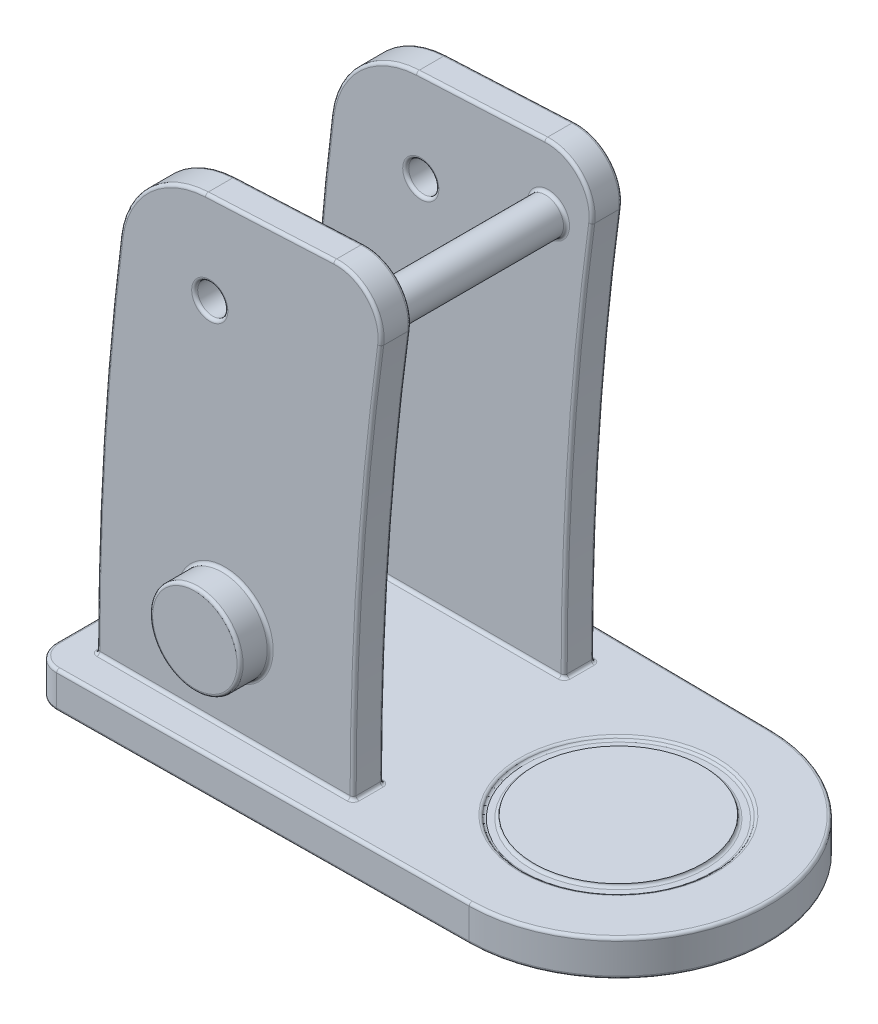
from build123d import *

# Parameters (mm, degrees)
EXTRUDE_1_DEPTH     = 12
SKETCH_2_R          = 32
SKETCH_2_R_2        = 28
CUT_EXTRUDE_1_DEPTH = 1
FILLET_1_R          = 1
EXTRUDE_START       = 40
EXTRUDE_2_DEPTH     = 10
EXTRUDE_START_2     = -30
EXTRUDE_3_DEPTH     = 10
SKETCH_6_R          = 15
EXTRUDE_4_DEPTH     = 10
SKETCH_7_R          = 6
EXTRUDE_5_DEPTH     = 70
SKETCH_8_R          = 5
CUT_EXTRUDE_2_DEPTH = 270.276900019
FILLET_2_R          = 1
FILLET_3_R          = 1


with BuildPart() as part:
    # 草图1 → 凸台-拉伸1 (new body)
    with BuildSketch(Plane(origin=(0, 0, 0), x_dir=(1, 0, 0), z_dir=(0, 1, 0))):
        with BuildLine():
            Line((0, -43.415798737), (0, 43.415798737))
            ThreePointArc((0, 43.415798737), (2.372836655, 49.102188865), (8.083758171, 51.415360261))
            Line((8.083758171, 51.415360261), (143.523488569, 49.997259522))
            ThreePointArc((143.523488569, 49.997259522), (193, 0), (143.523488569, -49.997259522))
            Line((143.523488569, -49.997259522), (8.083758171, -51.415360261))
            ThreePointArc((8.083758171, -51.415360261), (2.372836655, -49.102188865), (0, -43.415798737))
        make_face()
    extrude(amount=EXTRUDE_1_DEPTH)

    # 草图2 → 切除-拉伸1 (cut)
    with BuildSketch(Plane(origin=(0, 12, 0), x_dir=(1, 0, 0), z_dir=(0, 1, 0))):
        with Locations(Location((143, 0, 0), (0, 0, 270))):
            Circle(SKETCH_2_R)
        with Locations(Location((143, 0, 0), (0, 0, 270))):
            Circle(SKETCH_2_R_2, mode=Mode.SUBTRACT)
    extrude(amount=-CUT_EXTRUDE_1_DEPTH, mode=Mode.SUBTRACT)

    # 圆角1
    fillet_1_edges = [part.edges().sort_by_distance(p)[0] for p in [
        (143, 11, -32),
        (143, 11, -28),
    ]]
    fillet(fillet_1_edges, radius=FILLET_1_R - 0.0001)  # a hair under: the kernel refuses the full size

    # 草图5 → 凸台-拉伸2 (add)
    with BuildSketch(Plane.XY.offset(EXTRUDE_START)):
        with BuildLine():
            Line((46.013384531, 161.965520174), (88.572759855, 164.007760087))
            ThreePointArc((88.572759855, 164.007760087), (100.351881391, 159.15775757), (104.154401534, 147))
            ThreePointArc((104.154401534, 147), (97.29122524, 79.655012873), (95, 12))
            Line((95, 12), (10, 12))
            ThreePointArc((10, 12), (11.922285718, 73.974803383), (17.681752509, 135.711340206))
            ThreePointArc((17.681752509, 135.711340206), (27.06020076, 154.004614846), (46.013384531, 161.965520174))
        make_face()
    extrude(amount=-EXTRUDE_2_DEPTH)

    # 草图5<2> → 凸台-拉伸3 (add)
    with BuildSketch(Plane.XY.offset(EXTRUDE_START_2)):
        with BuildLine():
            Line((46.013384531, 161.965520174), (88.572759855, 164.007760087))
            ThreePointArc((88.572759855, 164.007760087), (100.351881391, 159.15775757), (104.154401534, 147))
            ThreePointArc((104.154401534, 147), (97.29122524, 79.655012873), (95, 12))
            Line((95, 12), (10, 12))
            ThreePointArc((10, 12), (11.922285718, 73.974803383), (17.681752509, 135.711340206))
            ThreePointArc((17.681752509, 135.711340206), (27.06020076, 154.004614846), (46.013384531, 161.965520174))
        make_face()
    extrude(amount=-EXTRUDE_3_DEPTH)

    # 草图6 → 凸台-拉伸4 (add)
    with BuildSketch(Plane.XY.offset(40)):
        with Locations(Location((52.5, 42, 0), (0, 0, 180))):
            Circle(SKETCH_6_R)
    extrude(amount=EXTRUDE_4_DEPTH)

    # 草图7 → 凸台-拉伸5 (add)
    with BuildSketch(Plane.XY.offset(40)):
        with Locations(Location((89.797727338, 143.00717369, 0), (0, 0, 180))):
            Circle(SKETCH_7_R)
    extrude(amount=-EXTRUDE_5_DEPTH)

    # 草图8 → 切除-拉伸2 (cut, through all)
    with BuildSketch(Plane(origin=(0, 0, -40), x_dir=(-1, 0, 0), z_dir=(0, 0, -1))):
        with Locations((-47.451299933, 132)):
            Circle(SKETCH_8_R)
    extrude(amount=-CUT_EXTRUDE_2_DEPTH, mode=Mode.SUBTRACT)

    # 圆角2
    fillet_2_edges = [part.edges().sort_by_distance(p)[0] for p in [
        (2.372836655, 12, -49.102188865),
        (0, 12, 0),
        (2.372836655, 12, 49.102188865),
        (143, 12, -32),
        (75.80362337, 12, 50.706309892),
        (11.922285718, 73.974803383, 30),
        (10, 12, 35),
        (27.06020076, 154.004614846, 30),
        (67.293072193, 162.98664013, 30),
        (100.351881391, 159.15775757, 30),
        (97.29122524, 79.655012873, 30),
        (52.5, 12, 30),
        (95, 12, 35),
        (11.922285718, 73.974803383, 40),
        (52.5, 12, 40),
        (97.29122524, 79.655012873, 40),
        (100.351881391, 159.15775757, 40),
        (67.293072193, 162.98664013, 40),
        (27.06020076, 154.004614846, 40),
        (193, 12, 0),
        (11.922285718, 73.974803383, -40),
        (52.5, 12, -40),
        (10, 12, -35),
        (97.29122524, 79.655012873, -40),
        (95, 12, -35),
        (100.351881391, 159.15775757, -40),
        (67.293072193, 162.98664013, -40),
        (27.06020076, 154.004614846, -40),
        (11.922285718, 73.974803383, -30),
        (52.5, 12, -30),
        (97.29122524, 79.655012873, -30),
        (100.351881391, 159.15775757, -30),
        (67.293072193, 162.98664013, -30),
        (27.06020076, 154.004614846, -30),
        (75.80362337, 0, 50.706309892),
        (67.5, 42, 40),
        (2.372836655, 0, 49.102188865),
        (0, 0, 0),
        (95.797727338, 143.00717369, 30),
        (95.797727338, 143.00717369, -30),
        (2.372836655, 0, -49.102188865),
        (75.80362337, 0, -50.706309892),
        (52.451299933, 132, 30),
        (52.451299933, 132, 40),
        (52.451299933, 132, -30),
        (52.451299933, 132, -40),
        (193, 0, 0),
        (75.80362337, 12, -50.706309892),
    ]]
    fillet(fillet_2_edges, radius=FILLET_2_R)

    # 圆角3
    fillet_3_edges = [part.edges().sort_by_distance(p)[0] for p in [
        (67.5, 42, 50),
    ]]
    fillet(fillet_3_edges, radius=FILLET_3_R)


solid = part.part
